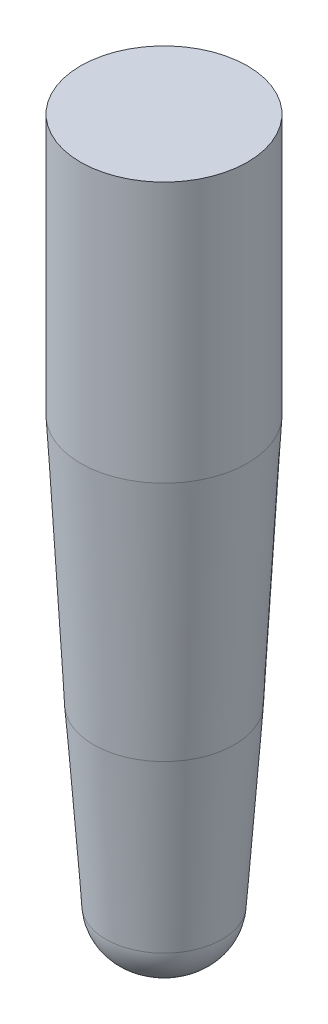
from build123d import *

# Parameters (mm, degrees)
SKETCH_608_R    = 8
EXTRUDE_1_DEPTH = 25


# Read off the part's stored shape, not the designer's step: 凸台-拉伸2
with BuildPart() as part:
    # Sketch 608 → 凸台-拉伸1 (new body)
    with BuildSketch(Plane(origin=(0, 0, 0), x_dir=(1, 0, 0), z_dir=(0, 1, 0))):
        with Locations(Location((0, 0, 0), (0, 0, 270))):
            Circle(SKETCH_608_R)
    extrude(amount=EXTRUDE_1_DEPTH)

    # 凸台-拉伸2 outline → 凸台-拉伸2 (revolve)
    with BuildSketch(Plane.XY):
        Polygon((0, -24), (6.742213297, -24), (8, 0), (0, 0), align=None)
    revolve(axis=Axis((0, 0, 0), (0, 1, 0)))

    # 草图7 → 旋转4 (revolve)
    with BuildSketch(Plane.XY, mode=Mode.PRIVATE) as revolve_4_sk:
        with BuildLine():
            Line((0, -24), (6.742213297, -24))
            Line((6.742213297, -24), (5.571871993, -40.736660394))
            ThreePointArc((5.571871993, -40.736660394), (4.125623062, -43.768784333), (1, -45))
            Line((1, -45), (0, -45))
            Line((0, -45), (0, -24))
        make_face()
    revolve(revolve_4_sk.sketch.rotate(Axis((0, -24, 0), (0, -1, 0)), 180), axis=Axis((0, -24, 0), (0, -1, 0)))


solid = part.part
